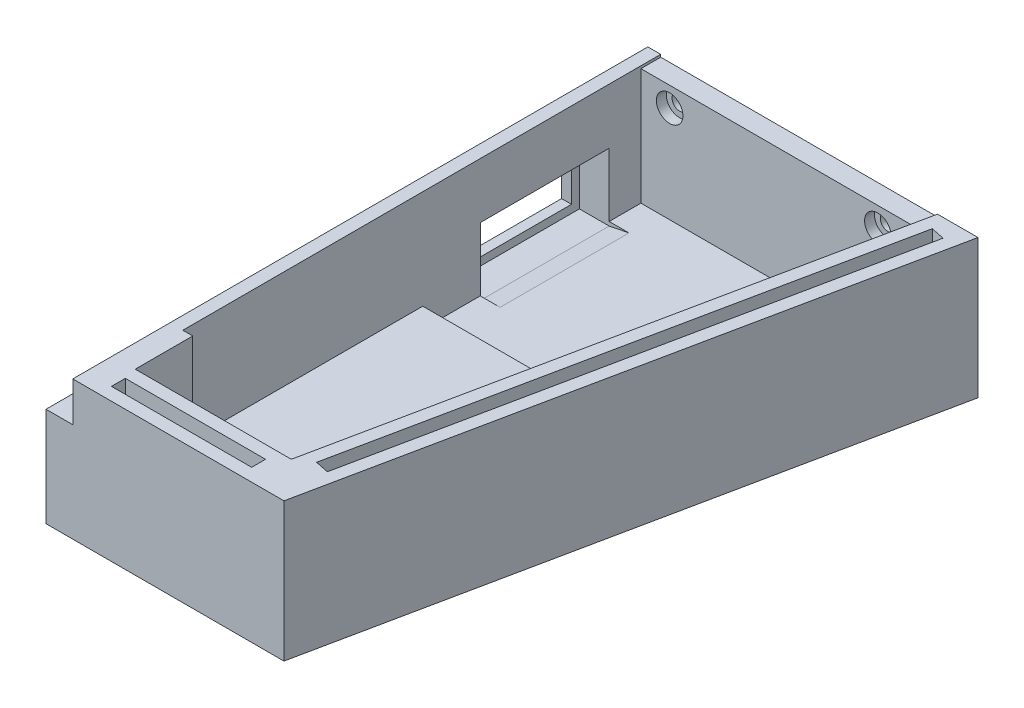
from build123d import *

# Parameters (mm, degrees)
BOSS_EXTRUDE1_DEPTH = 35
BOSS_EXTRUDE2_DEPTH = 10
SKETCH4_W           = 35.357177314
SKETCH4_H           = 3.5
CUT_EXTRUDE1_DEPTH  = 10
SKETCH5_W           = 68.753729038
SKETCH5_H           = 5
CUT_EXTRUDE2_DEPTH  = 0.625
CUT_EXTRUDE3_REACH  = 165.362
SKETCH6_R           = 1.9
SKETCH7_R           = 3.35
CUT_EXTRUDE4_DEPTH  = 2.5
LPATTERN1_COUNT     = 2
LPATTERN1_PITCH     = 52.5
SKETCH8_W           = 3.5
SKETCH8_H           = 145
SKETCH8_W_2         = 3.25
CUT_EXTRUDE5_DEPTH  = 10
SKETCH10_W          = 40
SKETCH10_H          = 55
CUT_EXTRUDE6_DEPTH  = 5
CUT_EXTRUDE7_REACH  = 178.378
SKETCH9_W           = 13
SKETCH9_H           = 28.5
SKETCH11_W          = 17
SKETCH11_H          = 32.5
SKETCH11_W_2        = 13
SKETCH11_H_2        = 28.5
CUT_EXTRUDE8_DEPTH  = 7.5
CHAMFER1_SIZE2      = 1
CHAMFER1_SIZE       = 5
SKETCH14_W          = 25
SKETCH14_H          = 14.5
BOSS_EXTRUDE3_DEPTH = 2.5
SKETCH13_R          = 2.4
CUT_EXTRUDE9_DEPTH  = 3.8


with BuildPart() as part:
    # Sketch1 → Boss-Extrude1 (new body)
    with BuildSketch(Plane(origin=(0, 0, 0), x_dir=(-1, 0, 0), z_dir=(0, 1, 0))):
        Polygon((66.563657866, 147.59508075), (16.563657866, 147.59508075), (26.356262061, 145.56902471), (24.706480552, 137.59508075), (66.563657866, 137.59508075), align=None)
        Polygon((26.356262061, 145.56902471), (16.563657866, 147.59508075), (16.563657866, 137.59508075), (24.706480552, 137.59508075), align=None)
        Polygon((16.563657866, 147.59508075), (-13.436342134, 2.59508075), (-8.436342134, 2.59508075), (-3.224553931, 2.59508075), (-3.224553931, 7.59508075), (-2.190071172, 7.59508075), (24.706480552, 137.59508075), (16.563657866, 137.59508075), align=None)
        Polygon((76.563657866, 147.59508075), (66.563657866, 147.59508075), (66.563657866, 137.59508075), (66.563657866, 7.59508075), (66.563657866, 2.59508075), (76.563657866, 2.59508075), align=None)
        Polygon((-3.224553931, 7.59508075), (-3.224553931, 2.59508075), (-2.190071172, 7.59508075), align=None)
        Polygon((-2.190071172, 7.59508075), (-3.224553931, 2.59508075), (66.563657866, 2.59508075), (66.563657866, 7.59508075), align=None)
    extrude(amount=BOSS_EXTRUDE1_DEPTH)

    # Sketch3 → Boss-Extrude2 (add)
    with BuildSketch(Plane.XZ):
        Polygon((-76.563657866, 147.59508075), (-16.563657866, 147.59508075), (13.436342134, 2.59508075), (-76.563657866, 2.59508075), align=None)
    extrude(amount=-BOSS_EXTRUDE2_DEPTH)

    # Sketch4 → Cut-Extrude1 (cut)
    with BuildSketch(Plane(origin=(0, 35, 0), x_dir=(-1, 0, 0), z_dir=(0, 1, 0))):
        Polygon((20.865415976, 135.0709526), (-5.748682081, 6.436145326), (-9.176093549, 7.145264941), (17.438004507, 135.780072214), align=None)
        with Locations((45.635069209, 142.59508075)):
            Rectangle(SKETCH4_W, SKETCH4_H)
    extrude(amount=-CUT_EXTRUDE1_DEPTH, mode=Mode.SUBTRACT)

    # Sketch5 → Cut-Extrude2 (cut)
    with BuildSketch(Plane(origin=(0, 35, -3.02991925), x_dir=(1, 0, 0), z_dir=(0, -1, 0))):
        Polygon((3.224553931, 5.625), (2.190071172, 10.625), (2.190071172, 5.625), align=None)
        with Locations((-32.186793347, 8.125)):
            Rectangle(SKETCH5_W, SKETCH5_H)
    extrude(amount=CUT_EXTRUDE2_DEPTH, mode=Mode.SUBTRACT)

    # Sketch6 → Cut-Extrude3 (cut, up to next)
    with BuildSketch(Plane.XY.offset(7.59508075), mode=Mode.PRIVATE) as cut_extrude3_sk1:
        with Locations((-59.313657866, 29.375)):
            Circle(SKETCH6_R)
    cut_extrude3_tool1 = extrude(cut_extrude3_sk1.sketch, amount=-CUT_EXTRUDE3_REACH, mode=Mode.PRIVATE) & part.part
    cut_extrude3 = cut_extrude3_tool1.solids().sort_by_distance((-59.313658, 29.375, 7.595081))[0]
    add(cut_extrude3, mode=Mode.SUBTRACT)

    # Sketch7 → Cut-Extrude4 (cut)
    with BuildSketch(Plane.XY.offset(7.59508075)):
        with Locations((-59.313657866, 29.375)):
            Circle(SKETCH7_R)
    cut_extrude4 = extrude(amount=-CUT_EXTRUDE4_DEPTH, mode=Mode.SUBTRACT)

    # LPattern1: Cut-Extrude3, Cut-Extrude4 ×2
    with Locations(*[(i * LPATTERN1_PITCH, 0, 0) for i in range(1, LPATTERN1_COUNT)]):
        add(cut_extrude3, mode=Mode.SUBTRACT)
        add(cut_extrude4, mode=Mode.SUBTRACT)

    # Sketch8 → Cut-Extrude5 (cut)
    with BuildSketch(Plane(origin=(0, 35, 0), x_dir=(-1, 0, 0), z_dir=(0, 1, 0))):
        with Locations((71.563657866, 75.09508075)):
            Rectangle(SKETCH8_W, SKETCH8_H)
        with Locations((74.938657866, 75.09508075)):
            Rectangle(SKETCH8_W_2, SKETCH8_H)
    extrude(amount=-CUT_EXTRUDE5_DEPTH, mode=Mode.SUBTRACT)

    # Sketch10 → Cut-Extrude6 (cut)
    with BuildSketch(Plane(origin=(0, 10, 0), x_dir=(-1, 0, 0), z_dir=(0, 1, 0))):
        Polygon((15.184347521, 7.59508075), (26.563657866, 7.59508075), (26.563657866, 62.59508075), align=None)
        with Locations((46.563657866, 35.09508075)):
            Rectangle(SKETCH10_W, SKETCH10_H)
    extrude(amount=-CUT_EXTRUDE6_DEPTH, mode=Mode.SUBTRACT)

    # Sketch9 → Cut-Extrude7 (cut, up to next)
    with BuildSketch(Plane(origin=(-76.563657866, 0, 0), x_dir=(0, -1, 0), z_dir=(-1, 0, 0)), mode=Mode.PRIVATE) as cut_extrude7_sk1:
        with Locations((-12.5, 31.84508075)):
            Rectangle(SKETCH9_W, SKETCH9_H)
    cut_extrude7_tool1 = extrude(cut_extrude7_sk1.sketch, amount=-CUT_EXTRUDE7_REACH, mode=Mode.PRIVATE) & part.part
    add(cut_extrude7_tool1.solids().sort_by_distance((-76.563658, 12.5, 31.845081))[0], mode=Mode.SUBTRACT)

    # Sketch11 → Cut-Extrude8 (cut)
    with BuildSketch(Plane.YZ.offset(-66.563657866)):
        with Locations((12.5, 31.84508075)):
            Rectangle(SKETCH11_W, SKETCH11_H)
        with Locations((12.5, 31.84508075)):
            Rectangle(SKETCH11_W_2, SKETCH11_H_2, mode=Mode.SUBTRACT)
    extrude(amount=-CUT_EXTRUDE8_DEPTH, mode=Mode.SUBTRACT)

    # Chamfer1
    chamfer1_edges = [part.edges().sort_by_distance(p)[0] for p in [
        (-66.563657866, 5, 31.84508075),
    ]]
    chamfer1_side = [part.faces().sort_by_distance(p)[0] for p in [
        (-66.543657866, 5, 31.84508075),
    ]]
    chamfer(chamfer1_edges, length=CHAMFER1_SIZE - 0.0001, length2=CHAMFER1_SIZE2 - 0.0001, reference=chamfer1_side[0])  # a hair under: the kernel refuses the full size

    # Sketch14 → Boss-Extrude3 (add)
    with BuildSketch(Plane.YZ.offset(-66.563657866)):
        with Locations((22.5, 130.34508075)):
            Rectangle(SKETCH14_W, SKETCH14_H)
    extrude(amount=BOSS_EXTRUDE3_DEPTH)

    # Sketch13 → Cut-Extrude9 (cut)
    with BuildSketch(Plane(origin=(-69.813657866, 0, 0), x_dir=(0, -1, 0), z_dir=(-1, 0, 0))):
        with Locations(Location((-30, 130.34508075, 0), (0, 0, 90))):
            Circle(SKETCH13_R)
    extrude(amount=-CUT_EXTRUDE9_DEPTH, mode=Mode.SUBTRACT)


solid = part.part
